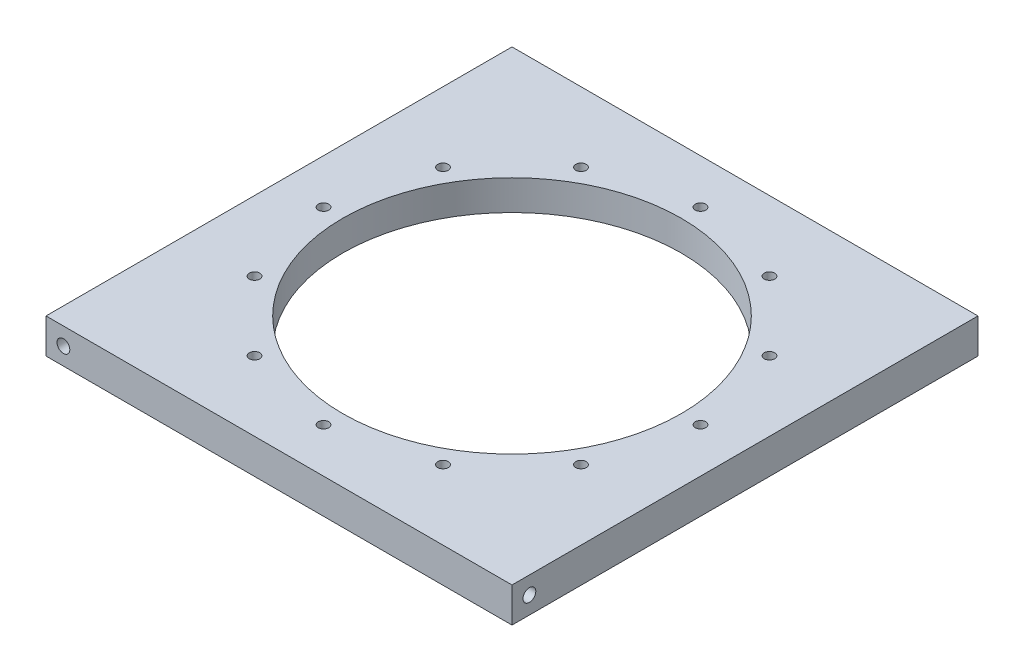
from build123d import *

# Parameters (mm, degrees)
SKETCH1_W           = 127.635
SKETCH1_H           = 127.635
BOSS_EXTRUDE1_DEPTH = 9.525
CUT_EXTRUDE1_DEPTH  = 9.525
SKETCH6_R           = 1.7526
F_6_32_HOLE1_DEPTH  = 6.35
SKETCH7_R           = 1.7526
F_6_32_HOLE2_DEPTH  = 6.35
SKETCH8_R           = 1.7526
F_6_32_HOLE3_DEPTH  = 6.35
SKETCH9_R           = 1.7526
F_6_32_HOLE4_DEPTH  = 6.35
SKETCH10_R          = 56.41975
CUT_EXTRUDE2_DEPTH  = 1.27
SKETCH11_R          = 1.4351
CUT_EXTRUDE3_DEPTH  = 181.754286464
CIRPATTERN1_COUNT   = 12


with BuildPart() as part:
    # Sketch1 → Boss-Extrude1 (new body)
    with BuildSketch(Plane(origin=(0, 0, 0), x_dir=(1, 0, 0), z_dir=(0, 1, 0))):
        with Locations((63.8175, 63.8175)):
            Rectangle(SKETCH1_W, SKETCH1_H)
    extrude(amount=BOSS_EXTRUDE1_DEPTH)

    # Sketch5 → Cut-Extrude1 (cut)
    with BuildSketch(Plane(origin=(0, 9.525, 0), x_dir=(1, 0, 0), z_dir=(0, 1, 0))):
        with BuildLine():
            ThreePointArc((63.8175, 110.1725), (17.4625, 63.8175), (63.8175, 17.4625))
            Line((63.8175, 17.4625), (63.8175, 110.1725))
        make_face()
        with BuildLine():
            Line((63.8175, 110.1725), (63.8175, 17.4625))
            ThreePointArc((63.8175, 17.4625), (96.595434842, 31.039565158), (110.1725, 63.8175))
            ThreePointArc((110.1725, 63.8175), (96.595434842, 96.595434842), (63.8175, 110.1725))
        make_face()
        with BuildLine():
            ThreePointArc((63.8175, 110.1725), (17.4625, 63.8175), (63.8175, 17.4625))
            Line((63.8175, 17.4625), (63.8175, 110.1725))
        make_face()
        with BuildLine():
            Line((63.8175, 110.1725), (63.8175, 17.4625))
            ThreePointArc((63.8175, 17.4625), (96.595434842, 31.039565158), (110.1725, 63.8175))
            ThreePointArc((110.1725, 63.8175), (96.595434842, 96.595434842), (63.8175, 110.1725))
        make_face()
    extrude(amount=-CUT_EXTRUDE1_DEPTH, mode=Mode.SUBTRACT)

    # Sketch6 → 6-32 hole1 (cut)
    with BuildSketch(Plane(origin=(127.635, 0, 0), x_dir=(0, 0, -1), z_dir=(1, 0, 0))):
        with Locations((4.7625, 4.7625)):
            Circle(SKETCH6_R)
    extrude(amount=-F_6_32_HOLE1_DEPTH, mode=Mode.SUBTRACT)

    # Sketch7 → 6-32 hole2 (cut)
    with BuildSketch(Plane(origin=(0, 0, -127.635), x_dir=(-1, 0, 0), z_dir=(0, 0, -1))):
        with Locations((-122.8725, 4.7625)):
            Circle(SKETCH7_R)
    extrude(amount=-F_6_32_HOLE2_DEPTH, mode=Mode.SUBTRACT)

    # Sketch8 → 6-32 hole3 (cut)
    with BuildSketch(Plane.ZY):
        with Locations((-122.8725, 4.7625)):
            Circle(SKETCH8_R)
    extrude(amount=-F_6_32_HOLE3_DEPTH, mode=Mode.SUBTRACT)

    # Sketch9 → 6-32 hole4 (cut)
    with BuildSketch(Plane.XY):
        with Locations((4.7625, 4.7625)):
            Circle(SKETCH9_R)
    extrude(amount=-F_6_32_HOLE4_DEPTH, mode=Mode.SUBTRACT)

    # Sketch10 → Cut-Extrude2 (cut)
    with BuildSketch(Plane.XZ):
        with Locations((63.8175, -63.8175)):
            Circle(SKETCH10_R)
    extrude(amount=-CUT_EXTRUDE2_DEPTH, mode=Mode.SUBTRACT)

    # Sketch11 → Cut-Extrude3 (cut, through all)
    with BuildSketch(Plane(origin=(0, 9.525, 0), x_dir=(1, 0, 0), z_dir=(0, 1, 0))):
        with Locations((63.8175, 115.443)):
            Circle(SKETCH11_R)
    cut_extrude3 = extrude(amount=-CUT_EXTRUDE3_DEPTH, mode=Mode.SUBTRACT)

    # CirPattern1: Cut-Extrude3 ×12 about axis
    cirpattern1_axis = Axis((63.8175, 9.525, -63.8175), (0, 1, 0))
    for i in range(1, CIRPATTERN1_COUNT):
        add(cut_extrude3.rotate(cirpattern1_axis, i * 360 / CIRPATTERN1_COUNT), mode=Mode.SUBTRACT)


solid = part.part
